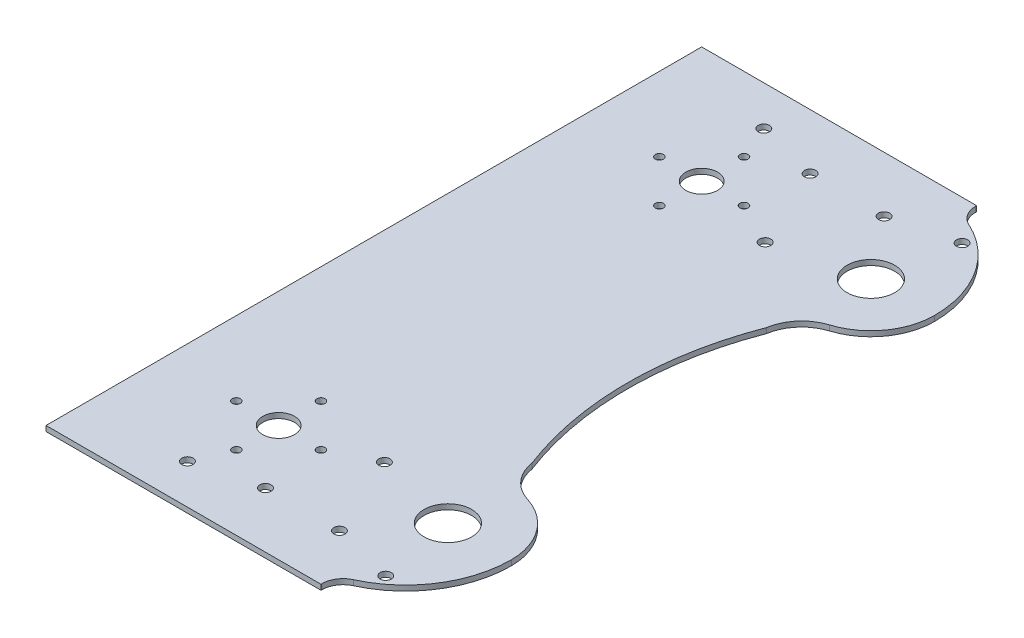
from build123d import *

# Parameters (mm, degrees)
SKETCH1_W                    = 165.1
SKETCH1_H                    = 393.7
BOSS_EXTRUDE1_DEPTH          = 3.175
CUT_EXTRUDE2_DEPTH           = 214.48186252
F_10_0_1935_DIAMETER_HOLE1_D = 4.9149
BOSS_EXTRUDE2_DEPTH          = 3.175
FILLET1_R                    = 12.7
SKETCH7_R                    = 14.2875
CUT_EXTRUDE3_DEPTH           = 235.284022343
CUT_EXTRUDE4_DEPTH           = 235.284022343
SKETCH10_R                   = 3.3782
CUT_EXTRUDE5_DEPTH           = 235.284022343


with BuildPart() as part:
    # Sketch1 → Boss-Extrude1 (new body)
    with BuildSketch(Plane(origin=(0, 0, 0), x_dir=(1, 0, 0), z_dir=(0, 1, 0))):
        Rectangle(SKETCH1_W, SKETCH1_H)
    extrude(amount=BOSS_EXTRUDE1_DEPTH)

    # Sketch3 → Cut-Extrude2 (cut, through all)
    with BuildSketch(Plane(origin=(0, 3.175, 0), x_dir=(1, 0, 0), z_dir=(0, 1, 0))):
        with BuildLine():
            ThreePointArc((-3.175, -127), (-12.7, -117.475), (-22.225, -127))
            ThreePointArc((-22.225, -127), (-12.7, -136.525), (-3.175, -127))
        make_face()
        with BuildLine():
            ThreePointArc((-3.175, 127), (-12.7, 136.525), (-22.225, 127))
            ThreePointArc((-22.225, 127), (-12.7, 117.475), (-3.175, 127))
        make_face()
    extrude(amount=-CUT_EXTRUDE2_DEPTH, mode=Mode.SUBTRACT)

    # #10 (0.1935) Diameter Hole1 (through all)
    with Locations(Plane(origin=(0, 3.175, 0), x_dir=(1, 0, 0), z_dir=(0, 1, 0))):
        with Locations((-12.7, -152.4), (-38.1, -127), (-12.7, -101.6), (12.7, -127), (-12.7, 152.4), (-38.1, 127), (-12.7, 101.6), (12.7, 127)):
            Hole(F_10_0_1935_DIAMETER_HOLE1_D / 2)

    # Sketch9 → Boss-Extrude2 (add)
    with BuildSketch(Plane(origin=(0, 0, 0), x_dir=(1, 0, 0), z_dir=(0, 1, 0))):
        with BuildLine():
            Line((82.55, 196.85), (82.55, 187.57513929))
            ThreePointArc((82.55, 187.57513929), (114.695336702, 164.567106623), (127, 127))
            ThreePointArc((127, 127), (119.617202021, 104.459736026), (100.33, 90.654916426))
            ThreePointArc((100.33, 90.654916426), (87.471865319, 81.451703359), (82.55, 66.42486071))
            Line((82.55, 66.42486071), (82.55, 57.15))
            Line((82.55, 57.15), (80.9625, 57.15))
            Line((80.9625, 57.15), (80.9625, 196.85))
            Line((80.9625, 196.85), (82.55, 196.85))
        make_face()
        with BuildLine():
            Line((80.9625, -196.85), (80.9625, -57.15))
            Line((80.9625, -57.15), (82.55, -57.15))
            Line((82.55, -57.15), (82.55, -66.42486071))
            ThreePointArc((82.55, -66.42486071), (87.471865319, -81.451703359), (100.33, -90.654916426))
            ThreePointArc((100.33, -90.654916426), (119.617202021, -104.459736026), (127, -127))
            ThreePointArc((127, -127), (114.695336702, -164.567106623), (82.55, -187.57513929))
            Line((82.55, -187.57513929), (82.55, -196.85))
            Line((82.55, -196.85), (80.9625, -196.85))
        make_face()
    extrude(amount=BOSS_EXTRUDE2_DEPTH)

    # Fillet1
    fillet1_edges = [part.edges().sort_by_distance(p)[0] for p in [
        (82.55, 1.5875, 187.57513929),
        (82.55, 1.5875, -187.57513929),
    ]]
    fillet(fillet1_edges, radius=FILLET1_R)

    # Sketch7 → Cut-Extrude3 (cut, through all)
    with BuildSketch(Plane(origin=(0, 3.175, 0), x_dir=(1, 0, 0), z_dir=(0, 1, 0))):
        with Locations((88.9, -127)):
            Circle(SKETCH7_R)
        with Locations((88.9, 127)):
            Circle(SKETCH7_R)
    extrude(amount=-CUT_EXTRUDE3_DEPTH, mode=Mode.SUBTRACT)

    # Sketch8 → Cut-Extrude4 (cut, through all)
    with BuildSketch(Plane(origin=(0, 3.175, 0), x_dir=(1, 0, 0), z_dir=(0, 1, 0))):
        with BuildLine():
            Line((87.471865319, 81.451703359), (87.471865319, -81.451703359))
            ThreePointArc((87.471865319, -81.451703359), (69.829963685, 0), (87.471865319, 81.451703359))
        make_face()
    extrude(amount=-CUT_EXTRUDE4_DEPTH, mode=Mode.SUBTRACT)

    # Sketch10 → Cut-Extrude5 (cut, through all)
    with BuildSketch(Plane(origin=(0, 3.175, 0), x_dir=(1, 0, 0), z_dir=(0, 1, 0))):
        with Locations((38.1, -114.3)):
            Circle(SKETCH10_R)
        with Locations((-21.43125, -173.0375)):
            Circle(SKETCH10_R)
        with Locations((15.875, -163.5125)):
            Circle(SKETCH10_R)
        with Locations((60.325, -163.5125)):
            Circle(SKETCH10_R)
        with Locations((97.63125, -173.0375)):
            Circle(SKETCH10_R)
        with Locations((97.63125, 173.0375)):
            Circle(SKETCH10_R)
        with Locations((60.325, 163.5125)):
            Circle(SKETCH10_R)
        with Locations((15.875, 163.5125)):
            Circle(SKETCH10_R)
        with Locations((38.1, 114.3)):
            Circle(SKETCH10_R)
        with Locations((-21.43125, 173.0375)):
            Circle(SKETCH10_R)
    extrude(amount=-CUT_EXTRUDE5_DEPTH, mode=Mode.SUBTRACT)


solid = part.part
